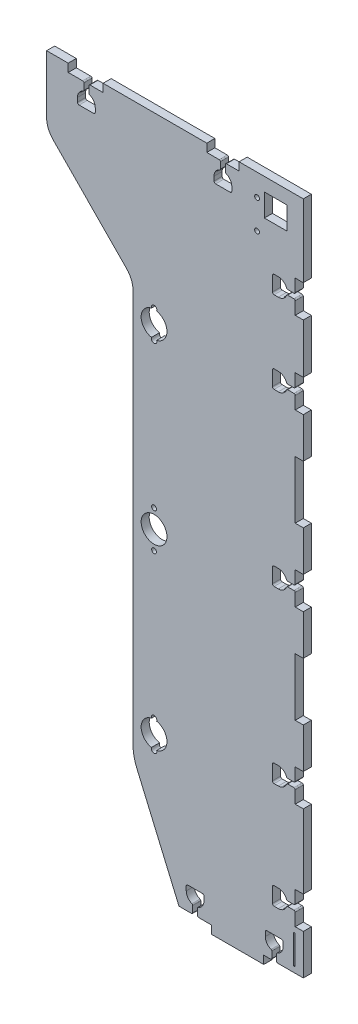
from build123d import *

# Parameters (mm, degrees)
MODEL_3_W           = 1
MODEL_3_H           = 17.999999995
MODEL_3_R           = 1.5
MODEL_3_R_2         = 7.999999998
MODEL_3_W_2         = 13.999999997
MODEL_3_H_2         = 13.999999996
BOSS_EXTRUDE2_DEPTH = 5
MODEL_4_R           = 1.5
CUT_EXTRUDE1_DEPTH  = 2


with BuildPart() as part:
    # Model<3> → Boss-Extrude2 (new body)
    with BuildSketch(Plane.XY):
        with BuildLine():
            Line((546, -45.000049616), (546, 0))
            Line((546, 0), (506.2, 0))
            Line((506.2, 0), (506.2, -4.999995184))
            Line((506.2, -4.999995184), (498.450183235, -4.999995184))
            add(Edge.make_bspline(
                [(497.700181648, -5.750174057), (497.700082843, -5.335890022), (498.035899189, -4.999994295), (498.450183235, -4.999995184)],
                knots=[12, 12, 12, 12, 13, 13, 13, 13], degree=3))
            Line((497.700181648, -5.750174057), (497.701039279, -9.675060997))
            add(Edge.make_bspline(
                [(498.177494802, -10.3691405), (497.890497562, -10.258189749), (497.701556482, -9.982757629), (497.701039279, -9.675060997)],
                knots=[10, 10, 10, 10, 11, 11, 11, 11], degree=3))
            add(Edge.make_bspline(
                [(501.699914986, -15.500447692), (501.700368749, -13.17121262), (500.233348771, -11.167782837), (498.177494802, -10.3691405)],
                knots=[9, 9, 9, 9, 10, 10, 10, 10], degree=3))
            Line((501.699914986, -15.500447692), (501.699914986, -18.100120624))
            add(Edge.make_bspline(
                [(500.699914986, -19.100120624), (501.252199736, -19.100120624), (501.699914986, -18.652405374), (501.699914986, -18.100120624)],
                knots=[7, 7, 7, 7, 8, 8, 8, 8], degree=3))
            Line((500.699914986, -19.100120624), (491.700072268, -19.100120624))
            add(Edge.make_bspline(
                [(490.700072268, -18.100120624), (490.700072268, -18.652405374), (491.147787518, -19.100120624), (491.700072268, -19.100120624)],
                knots=[5, 5, 5, 5, 6, 6, 6, 6], degree=3))
            Line((490.700072268, -18.100120624), (490.700072268, -15.500447692))
            add(Edge.make_bspline(
                [(494.223229174, -10.368798467), (492.166969791, -11.167255583), (490.699594835, -13.170914765), (490.700072268, -15.500447692)],
                knots=[3, 3, 3, 3, 4, 4, 4, 4], degree=3))
            add(Edge.make_bspline(
                [(494.699861114, -9.674560885), (494.699380955, -9.982359671), (494.510347119, -10.257876835), (494.223229174, -10.368798467)],
                knots=[2, 2, 2, 2, 3, 3, 3, 3], degree=3))
            Line((494.699861114, -9.674560885), (494.700037911, -5.750027353))
            add(Edge.make_bspline(
                [(493.965462797, -4.999995184), (494.364264669, -4.999993567), (494.700056571, -5.335800597), (494.700037911, -5.750027353)],
                knots=[0, 0, 0, 0, 1, 1, 1, 1], degree=3))
            Line((493.965462797, -4.999995184), (486.215646033, -4.999995184))
            Line((486.215646033, -4.999995184), (486.2, -4.999995184))
            Line((486.2, -4.999995184), (486.2, 0))
            Line((486.2, 0), (421.975, 0))
            Line((421.975, 0), (421.975, -4.999995184))
            Line((421.975, -4.999995184), (413.870038307, -4.999995184))
            add(Edge.make_bspline(
                [(413.870038307, -4.999995184), (413.455754261, -4.99999518), (413.119938632, -5.335891625), (413.120038323, -5.750175659)],
                knots=[6, 6, 6, 6, 7, 7, 7, 7], degree=3))
            Line((413.120038323, -5.750175659), (413.120825498, -9.675062614))
            add(Edge.make_bspline(
                [(413.120825498, -9.675062614), (413.121342701, -9.982759246), (413.310283781, -10.258191366), (413.59728102, -10.369142117)],
                knots=[8, 8, 8, 8, 9, 9, 9, 9], degree=3))
            add(Edge.make_bspline(
                [(413.59728102, -10.369142117), (415.65313499, -11.167784454), (417.120154968, -13.171214237), (417.119701204, -15.500449309)],
                knots=[9, 9, 9, 9, 10, 10, 10, 10], degree=3))
            Line((417.119701204, -15.500449309), (417.119701204, -18.100122241))
            add(Edge.make_bspline(
                [(417.119701204, -18.100122241), (417.119701205, -18.652406991), (416.671985955, -19.100122241), (416.119701205, -19.100122241)],
                knots=[11, 11, 11, 11, 12, 12, 12, 12], degree=3))
            Line((416.119701205, -19.100122241), (407.119858486, -19.100122241))
            add(Edge.make_bspline(
                [(407.119858486, -19.100122241), (406.567573736, -19.100122241), (406.119858486, -18.652406991), (406.119858486, -18.100122241)],
                knots=[13, 13, 13, 13, 14, 14, 14, 14], degree=3))
            Line((406.119858486, -18.100122241), (406.119858486, -15.500449309))
            add(Edge.make_bspline(
                [(406.119858486, -15.500449309), (406.119381054, -13.170916382), (407.58675601, -11.1672572), (409.643015392, -10.368800084)],
                knots=[15, 15, 15, 15, 16, 16, 16, 16], degree=3))
            add(Edge.make_bspline(
                [(409.643015392, -10.368800084), (409.930133337, -10.257878452), (410.119167173, -9.982361288), (410.119647333, -9.674562503)],
                knots=[16, 16, 16, 16, 17, 17, 17, 17], degree=3))
            Line((410.119647333, -9.674562503), (410.119824129, -5.75002897))
            add(Edge.make_bspline(
                [(410.119824129, -5.75002897), (410.11984279, -5.335802214), (409.784050887, -4.999995184), (409.36982413, -4.999995184)],
                knots=[18, 18, 18, 18, 19, 19, 19, 19], degree=3))
            Line((409.36982413, -4.999995184), (400.375, -4.999995184))
            Line((400.375, -4.999995184), (400.375, 0))
            Line((400.375, 0), (387.000004816, 0))
            Line((387.000004816, 0), (387.000004816, -36))
            ThreePointArc((387.000004816, -36), (388.04243776, -41.301080643), (391.014498528, -45.8127297))
            Line((391.014498528, -45.8127297), (436.509430757, -92.108709079))
            ThreePointArc((436.509430757, -92.108709079), (439.481491525, -96.620358136), (440.523924468, -101.921438779))
            Line((440.523924468, -101.921438779), (440.523924468, -345.813078726))
            ThreePointArc((440.523924468, -345.813078726), (441.09581748, -351.443260518), (442.788134969, -356.843452195))
            Line((442.788134969, -356.843452195), (469, -418.000315354))
            Line((469, -418.000315354), (476.749816765, -418.000315354))
            add(Edge.make_bspline(
                [(477.499608369, -417.249926607), (477.499823121, -417.664210598), (477.164100795, -418.000200297), (476.749816765, -418.000315354)],
                knots=[16, 16, 16, 16, 17, 17, 17, 17], degree=3))
            Line((477.499608369, -417.249926607), (477.479585777, -413.325090645))
            add(Edge.make_bspline(
                [(477.003130255, -412.631011143), (477.290127494, -412.741961893), (477.479068574, -413.017394014), (477.479585777, -413.325090645)],
                knots=[14, 14, 14, 14, 15, 15, 15, 15], degree=3))
            add(Edge.make_bspline(
                [(473.480710071, -407.49970395), (473.480256308, -409.828939023), (474.947276286, -411.832368806), (477.003130255, -412.631011143)],
                knots=[13, 13, 13, 13, 14, 14, 14, 14], degree=3))
            Line((473.480710071, -407.49970395), (473.480710071, -404.900031018))
            add(Edge.make_bspline(
                [(474.480710071, -403.900031018), (473.928425321, -403.900031018), (473.480710071, -404.347746268), (473.480710071, -404.900031018)],
                knots=[11, 11, 11, 11, 12, 12, 12, 12], degree=3))
            Line((474.480710071, -403.900031018), (483.48055279, -403.900031018))
            add(Edge.make_bspline(
                [(484.480552789, -404.900031018), (484.480552789, -404.347746269), (484.032837539, -403.900031018), (483.48055279, -403.900031018)],
                knots=[9, 9, 9, 9, 10, 10, 10, 10], degree=3))
            Line((484.480552789, -404.900031018), (484.480552789, -407.49970395))
            add(Edge.make_bspline(
                [(480.957395883, -412.631353175), (483.013655265, -411.83289606), (484.481030222, -409.829236878), (484.480552789, -407.49970395)],
                knots=[7, 7, 7, 7, 8, 8, 8, 8], degree=3))
            add(Edge.make_bspline(
                [(480.480763942, -413.325590757), (480.481244102, -413.017791971), (480.670277938, -412.742274807), (480.957395883, -412.631353175)],
                knots=[6, 6, 6, 6, 7, 7, 7, 7], degree=3))
            Line((480.480763942, -413.325590757), (480.480744467, -417.250124293))
            add(Edge.make_bspline(
                [(481.230587151, -418.000315354), (480.816360403, -418.000228482), (480.480638934, -417.664351036), (480.480744467, -417.250124293)],
                knots=[4, 4, 4, 4, 5, 5, 5, 5], degree=3))
            Line((481.230587151, -418.000315354), (489, -418.000315354))
            Line((489, -418.000315354), (489, -423.000310538))
            Line((489, -423.000310538), (521.5, -423.000310538))
            Line((521.5, -423.000310538), (521.5, -418.000315354))
            Line((521.5, -418.000315354), (525.730371592, -418.000315354))
            add(Edge.make_bspline(
                [(526.480214256, -417.249977629), (526.480400817, -417.664261633), (526.14465563, -418.000228487), (525.730371592, -418.000315354)],
                knots=[112, 112, 112, 112, 113, 113, 113, 113], degree=3))
            Line((526.480214256, -417.249977629), (526.479584396, -413.325090645))
            add(Edge.make_bspline(
                [(526.003128873, -412.631011143), (526.290126113, -412.741961893), (526.479067193, -413.017394014), (526.479584396, -413.325090645)],
                knots=[110, 110, 110, 110, 111, 111, 111, 111], degree=3))
            add(Edge.make_bspline(
                [(522.480708689, -407.49970395), (522.480254926, -409.828939023), (523.947274904, -411.832368806), (526.003128873, -412.631011143)],
                knots=[109, 109, 109, 109, 110, 110, 110, 110], degree=3))
            Line((522.480708689, -407.49970395), (522.480708689, -404.900031018))
            add(Edge.make_bspline(
                [(523.480708689, -403.900031018), (522.928423939, -403.900031018), (522.480708689, -404.347746268), (522.480708689, -404.900031018)],
                knots=[107, 107, 107, 107, 108, 108, 108, 108], degree=3))
            Line((523.480708689, -403.900031018), (532.480551408, -403.900031018))
            add(Edge.make_bspline(
                [(533.480551408, -404.900031018), (533.480551408, -404.347746269), (533.032836158, -403.900031018), (532.480551408, -403.900031018)],
                knots=[105, 105, 105, 105, 106, 106, 106, 106], degree=3))
            Line((533.480551408, -404.900031018), (533.480551408, -407.49970395))
            add(Edge.make_bspline(
                [(529.957394501, -412.631353175), (532.013653884, -411.83289606), (533.48102884, -409.829236878), (533.480551408, -407.49970395)],
                knots=[103, 103, 103, 103, 104, 104, 104, 104], degree=3))
            add(Edge.make_bspline(
                [(529.480762561, -413.325590757), (529.48124272, -413.017791971), (529.670276556, -412.742274807), (529.957394501, -412.631353175)],
                knots=[102, 102, 102, 102, 103, 103, 103, 103], degree=3))
            Line((529.480762561, -413.325590757), (529.480743085, -417.250124293))
            add(Edge.make_bspline(
                [(530.230585769, -418.000315354), (529.816359021, -418.000228482), (529.480637552, -417.664351036), (529.480743085, -417.250124293)],
                knots=[100, 100, 100, 100, 101, 101, 101, 101], degree=3))
            Line((530.230585769, -418.000315354), (546, -418.000315354))
            Line((546, -418.000315354), (546, -393.000315354))
            Line((546, -393.000315354), (541.000004816, -393.000315354))
            Line((541.000004816, -393.000315354), (541.000004816, -385.250498589))
            add(Edge.make_bspline(
                [(540.249824408, -384.500498538), (540.664108443, -384.500398884), (541.000004857, -384.836214543), (541.000004816, -385.250498589)],
                knots=[95, 95, 95, 95, 96, 96, 96, 96], degree=3))
            Line((540.249824408, -384.500498538), (536.324937387, -384.500821507))
            add(Edge.make_bspline(
                [(535.630171673, -384.976277386), (535.741535769, -384.689439943), (536.017240011, -384.500895552), (536.324937387, -384.500821507)],
                knots=[93, 93, 93, 93, 94, 94, 94, 94], degree=3))
            add(Edge.make_bspline(
                [(530.499256385, -388.498804784), (532.828393271, -388.499142445), (534.831665469, -387.032084475), (535.630171673, -384.976277386)],
                knots=[92, 92, 92, 92, 93, 93, 93, 93], degree=3))
            Line((530.499256385, -388.498804784), (527.899583453, -388.498804784))
            add(Edge.make_bspline(
                [(526.899424235, -387.498964027), (526.899512176, -388.05124877), (527.34729871, -388.498892724), (527.899583453, -388.498804784)],
                knots=[90, 90, 90, 90, 91, 91, 91, 91], degree=3))
            Line((526.899424235, -387.498964027), (526.899424235, -378.499121308))
            add(Edge.make_bspline(
                [(527.899264967, -377.498962066), (527.346980224, -377.49905002), (526.899336281, -377.946836566), (526.899424235, -378.499121308)],
                knots=[88, 88, 88, 88, 89, 89, 89, 89], degree=3))
            Line((527.899264967, -377.498962066), (530.498937899, -377.498962066))
            add(Edge.make_bspline(
                [(535.630587123, -381.022118973), (534.832130008, -378.965859591), (532.828470826, -377.498484634), (530.498937899, -377.498962066)],
                knots=[86, 86, 86, 86, 87, 87, 87, 87], degree=3))
            add(Edge.make_bspline(
                [(536.324824704, -381.498750914), (536.017025919, -381.498270754), (535.741508755, -381.309236918), (535.630587123, -381.022118973)],
                knots=[85, 85, 85, 85, 86, 86, 86, 86], degree=3))
            Line((536.324824704, -381.498750914), (540.249358056, -381.499953617))
            add(Edge.make_bspline(
                [(541.000004816, -380.75056712), (540.999666131, -381.164793738), (540.663584659, -381.500310962), (540.249358056, -381.499953617)],
                knots=[83, 83, 83, 83, 84, 84, 84, 84], degree=3))
            Line((541.000004816, -380.75056712), (541.000004816, -373.000153812))
            Line((541.000004816, -373.000153812), (546, -373.000153812))
            Line((546, -373.000153812), (546, -327.250153812))
            Line((546, -327.250153812), (541.000004816, -327.250153812))
            Line((541.000004816, -327.250153812), (541.000004816, -319.500337047))
            add(Edge.make_bspline(
                [(540.249367335, -318.750794457), (540.663651232, -318.750442249), (540.999752302, -319.086053078), (541.000004816, -319.500337047)],
                knots=[77, 77, 77, 77, 78, 78, 78, 78], degree=3))
            Line((540.249367335, -318.750794457), (536.324480304, -318.750951063))
            add(Edge.make_bspline(
                [(535.62971459, -319.226406943), (535.741078686, -318.939569499), (536.016782928, -318.751025108), (536.324480304, -318.750951063)],
                knots=[75, 75, 75, 75, 76, 76, 76, 76], degree=3))
            add(Edge.make_bspline(
                [(530.499093608, -322.749686579), (532.828299069, -322.749729827), (534.831444762, -321.28237546), (535.62971459, -319.226406943)],
                knots=[74, 74, 74, 74, 75, 75, 75, 75], degree=3))
            Line((530.499093608, -322.749686579), (527.899420676, -322.749686579))
            add(Edge.make_bspline(
                [(526.899424235, -321.74968302), (526.89942227, -322.30196777), (527.347135926, -322.749684614), (527.899420676, -322.749686579)],
                knots=[72, 72, 72, 72, 73, 73, 73, 73], degree=3))
            Line((526.899424235, -321.74968302), (526.899424235, -312.749840301))
            add(Edge.make_bspline(
                [(527.900040588, -311.750457034), (527.347755943, -311.750116527), (526.899764742, -312.197555657), (526.899424235, -312.749840301)],
                knots=[70, 70, 70, 70, 71, 71, 71, 71], degree=3))
            Line((527.900040588, -311.750457034), (530.49971352, -311.750457034))
            add(Edge.make_bspline(
                [(535.631222491, -315.273818205), (534.832847229, -313.217527043), (532.829246461, -311.750072332), (530.49971352, -311.750457034)],
                knots=[68, 68, 68, 68, 69, 69, 69, 69], degree=3))
            add(Edge.make_bspline(
                [(536.325441056, -315.750477752), (536.017642309, -315.74998534), (535.742132687, -315.560940548), (535.631222491, -315.273818205)],
                knots=[67, 67, 67, 67, 68, 68, 68, 68], degree=3))
            Line((536.325441056, -315.750477752), (540.24997459, -315.750341487))
            add(Edge.make_bspline(
                [(541.000004816, -315.000337928), (541.000006783, -315.414564685), (540.664201346, -315.750358181), (540.24997459, -315.750341487)],
                knots=[65, 65, 65, 65, 66, 66, 66, 66], degree=3))
            Line((541.000004816, -315.000337928), (541.000004816, -307.249924619))
            Line((541.000004816, -307.249924619), (546, -307.249924619))
            Line((546, -307.249924619), (546, -282.249924619))
            Line((546, -282.249924619), (541.000004816, -282.249924619))
            Line((541.000004816, -282.249924619), (541.000004816, -246.499924619))
            Line((541.000004816, -246.499924619), (546, -246.499924619))
            Line((546, -246.499924619), (546, -221.499924619))
            Line((546, -221.499924619), (541.000004816, -221.499924619))
            Line((541.000004816, -221.499924619), (541.000004816, -213.750107855))
            add(Edge.make_bspline(
                [(540.248143442, -213.00179295), (540.66242621, -213.000763724), (540.999075284, -213.335824851), (541.000004816, -213.750107855)],
                knots=[55, 55, 55, 55, 56, 56, 56, 56], degree=3))
            Line((540.248143442, -213.00179295), (536.323256526, -213.000833683))
            add(Edge.make_bspline(
                [(535.629251123, -213.477396783), (535.740157315, -213.190382399), (536.015560051, -213.001398629), (536.323256526, -213.000833683)],
                knots=[53, 53, 53, 53, 54, 54, 54, 54], degree=3))
            add(Edge.make_bspline(
                [(530.498489816, -217.000613604), (532.827725258, -217.000705958), (534.830927673, -215.533374935), (535.629251123, -213.477396783)],
                knots=[52, 52, 52, 52, 53, 53, 53, 53], degree=3))
            Line((530.498489816, -217.000613604), (527.898816884, -217.000613604))
            add(Edge.make_bspline(
                [(526.899424235, -216.000006621), (526.899088906, -216.552291269), (527.346532236, -217.000278275), (527.898816884, -217.000613604)],
                knots=[50, 50, 50, 50, 51, 51, 51, 51], degree=3))
            Line((526.899424235, -216.000006621), (526.899424235, -207.000163902))
            add(Edge.make_bspline(
                [(527.899871774, -206.000611642), (527.347587079, -206.000364417), (526.899671459, -206.447879208), (526.899424235, -207.000163902)],
                knots=[48, 48, 48, 48, 49, 49, 49, 49], degree=3))
            Line((527.899871774, -206.000611642), (530.499544706, -206.000611642))
            add(Edge.make_bspline(
                [(535.630479962, -209.524808483), (534.832439549, -207.468387291), (532.829077731, -206.000606291), (530.499544706, -206.000611642)],
                knots=[46, 46, 46, 46, 47, 47, 47, 47], degree=3))
            add(Edge.make_bspline(
                [(536.325439608, -210.000388702), (536.017640095, -210.000374836), (535.741836558, -209.811758389), (535.630479962, -209.524808483)],
                knots=[45, 45, 45, 45, 46, 46, 46, 46], degree=3))
            Line((536.325439608, -210.000388702), (540.249973143, -210.00034004))
            add(Edge.make_bspline(
                [(541.000004816, -209.250337928), (541.000005984, -209.664564685), (540.6641999, -210.000357534), (540.249973143, -210.00034004)],
                knots=[43, 43, 43, 43, 44, 44, 44, 44], degree=3))
            Line((541.000004816, -209.250337928), (541.000004816, -201.499924619))
            Line((541.000004816, -201.499924619), (546, -201.499924619))
            Line((546, -201.499924619), (546, -176.499924619))
            Line((546, -176.499924619), (541.000004816, -176.499924619))
            Line((541.000004816, -176.499924619), (541.000004816, -140.749924619))
            Line((541.000004816, -140.749924619), (546, -140.749924619))
            Line((546, -140.749924619), (546, -115.750049616))
            Line((546, -115.750049616), (541.000004816, -115.750049616))
            Line((541.000004816, -115.750049616), (541.000004816, -108.00017058))
            add(Edge.make_bspline(
                [(540.249070095, -107.250925783), (540.663353819, -107.250409253), (540.99958798, -107.585886743), (541.000004816, -108.00017058)],
                knots=[33, 33, 33, 33, 34, 34, 34, 34], degree=3))
            Line((540.249070095, -107.250925783), (536.324183083, -107.251338023))
            add(Edge.make_bspline(
                [(535.63010358, -107.727793546), (535.74105433, -107.440796306), (536.016486451, -107.251855226), (536.324183083, -107.251338023)],
                knots=[31, 31, 31, 31, 32, 32, 32, 32], degree=3))
            add(Edge.make_bspline(
                [(530.498796387, -111.250213728), (532.828031459, -111.250667492), (534.831461242, -109.783647515), (535.63010358, -107.727793546)],
                knots=[30, 30, 30, 30, 31, 31, 31, 31], degree=3))
            Line((530.498796387, -111.250213728), (527.899123455, -111.250213728))
            add(Edge.make_bspline(
                [(526.899424235, -110.249913038), (526.899258144, -110.802197763), (527.34683873, -111.250047637), (527.899123455, -111.250213728)],
                knots=[28, 28, 28, 28, 29, 29, 29, 29], degree=3))
            Line((526.899424235, -110.249913038), (526.899424235, -101.250070319))
            add(Edge.make_bspline(
                [(527.899724836, -100.25037101), (527.347440111, -100.250204968), (526.899590277, -100.697785594), (526.899424235, -101.250070319)],
                knots=[26, 26, 26, 26, 27, 27, 27, 27], degree=3))
            Line((527.899724836, -100.25037101), (530.499397768, -100.25037101))
            add(Edge.make_bspline(
                [(535.631183762, -103.773328708), (534.832646823, -101.717100321), (532.828930677, -100.249803146), (530.499397768, -100.25037101)],
                knots=[24, 24, 24, 24, 25, 25, 25, 25], degree=3))
            add(Edge.make_bspline(
                [(536.325439886, -104.249933726), (536.017641064, -104.249465515), (535.742116546, -104.060442364), (535.631183762, -103.773328708)],
                knots=[23, 23, 23, 23, 24, 24, 24, 24], degree=3))
            Line((536.325439886, -104.249933726), (540.249973422, -104.249958794))
            add(Edge.make_bspline(
                [(541.000004816, -103.499956403), (541.000006137, -103.91418316), (540.664200178, -104.249976133), (540.249973422, -104.249958794)],
                knots=[21, 21, 21, 21, 22, 22, 22, 22], degree=3))
            Line((541.000004816, -103.499956403), (541.000004816, -95.750049616))
            Line((541.000004816, -95.750049616), (546, -95.750049616))
            Line((546, -95.750049616), (546, -65.000049616))
            Line((546, -65.000049616), (541.000004816, -65.000049616))
            Line((541.000004816, -65.000049616), (541.000004816, -57.25017058))
            add(Edge.make_bspline(
                [(540.249370897, -56.500624423), (540.663654795, -56.500274184), (540.999754271, -56.835886609), (541.000004816, -57.25017058)],
                knots=[15, 15, 15, 15, 16, 16, 16, 16], degree=3))
            Line((540.249370897, -56.500624423), (536.324483863, -56.500661326))
            add(Edge.make_bspline(
                [(535.63040436, -56.977116849), (535.741355111, -56.690119609), (536.016787232, -56.501178529), (536.324483863, -56.500661326)],
                knots=[13, 13, 13, 13, 14, 14, 14, 14], degree=3))
            add(Edge.make_bspline(
                [(530.499097167, -60.499537031), (532.828332239, -60.499990795), (534.831762023, -59.032970818), (535.63040436, -56.977116849)],
                knots=[12, 12, 12, 12, 13, 13, 13, 13], degree=3))
            Line((530.499097167, -60.499537031), (527.899424235, -60.499537031))
            add(Edge.make_bspline(
                [(526.899424235, -59.499537031), (526.899424235, -60.051821781), (527.347139485, -60.499537031), (527.899424235, -60.499537031)],
                knots=[10, 10, 10, 10, 11, 11, 11, 11], degree=3))
            Line((526.899424235, -59.499537031), (526.899424235, -50.499694313))
            add(Edge.make_bspline(
                [(527.89987776, -49.500148043), (527.347593067, -49.499897511), (526.899674767, -49.94740962), (526.899424235, -50.499694313)],
                knots=[8, 8, 8, 8, 9, 9, 9, 9], degree=3))
            Line((527.89987776, -49.500148043), (530.499550692, -49.500148043))
            add(Edge.make_bspline(
                [(535.631199916, -53.02330495), (534.832742801, -50.967045568), (532.829083619, -49.499670611), (530.499550692, -49.500148043)],
                knots=[6, 6, 6, 6, 7, 7, 7, 7], degree=3))
            add(Edge.make_bspline(
                [(536.325437497, -53.499936891), (536.017638712, -53.499456731), (535.742121548, -53.310422895), (535.631199916, -53.02330495)],
                knots=[5, 5, 5, 5, 6, 6, 6, 6], degree=3))
            Line((536.325437497, -53.499936891), (540.249971033, -53.499956406))
            add(Edge.make_bspline(
                [(541.000004816, -52.749956403), (541.000004818, -53.16418316), (540.66419779, -53.499975064), (540.249971033, -53.499956406)],
                knots=[3, 3, 3, 3, 4, 4, 4, 4], degree=3))
            Line((541.000004816, -52.749956403), (541.000004816, -45.000049616))
            Line((541.000004816, -45.000049616), (546, -45.000049616))
        make_face()
        with Locations((540.500004816, -405.499988277)):
            Rectangle(MODEL_3_W, MODEL_3_H, mode=Mode.SUBTRACT)
        with BuildLine():
            ThreePointArc((455.143804542, -341.328481021), (453.54463361, -343.700224656), (451.945462679, -341.328481021))
            ThreePointArc((451.945462679, -341.328481021), (445.54463361, -333.489944656), (451.945462679, -325.651408292))
            ThreePointArc((451.945462679, -325.651408292), (453.54463361, -323.279664657), (455.143804542, -325.651408292))
            ThreePointArc((455.143804542, -325.651408292), (461.54463361, -333.489944656), (455.143804542, -341.328481021))
        make_face(mode=Mode.SUBTRACT)
        with Locations((453.54463361, -234.989945577)):
            Circle(MODEL_3_R, mode=Mode.SUBTRACT)
        with Locations((453.54463361, -223.489944656)):
            Circle(MODEL_3_R_2, mode=Mode.SUBTRACT)
        with Locations((453.54463361, -211.989943735)):
            Circle(MODEL_3_R, mode=Mode.SUBTRACT)
        with BuildLine():
            ThreePointArc((455.143804542, -105.651408292), (461.54463361, -113.489944656), (455.143804542, -121.328481021))
            ThreePointArc((455.143804542, -121.328481021), (453.54463361, -123.700224656), (451.945462679, -121.328481021))
            ThreePointArc((451.945462679, -121.328481021), (445.54463361, -113.489944656), (451.945462679, -105.651408292))
            ThreePointArc((451.945462679, -105.651408292), (453.54463361, -103.279664657), (455.143804542, -105.651408292))
        make_face(mode=Mode.SUBTRACT)
        with Locations((528.880000002, -15.349999998)):
            Rectangle(MODEL_3_W_2, MODEL_3_H_2, mode=Mode.SUBTRACT)
        with Locations((517.380000004, -31.6)):
            Circle(MODEL_3_R, mode=Mode.SUBTRACT)
        with Locations((517.380000004, -13.6)):
            Circle(MODEL_3_R, mode=Mode.SUBTRACT)
    extrude(amount=BOSS_EXTRUDE2_DEPTH)

    # Model<4> → Cut-Extrude1 (cut)
    # profile 1 of 2: a face of its own
    with BuildSketch(Plane.XY):
        Polygon((520.130000004, -12.01228676), (517.380000004, -10.424573519), (514.630000004, -12.01228676), (514.630000004, -15.18771324), (517.380000004, -16.775426481), (520.130000004, -15.18771324), align=None)
        with Locations((517.380000004, -13.6)):
            Circle(MODEL_4_R, mode=Mode.SUBTRACT)
    # profile 2 of 2: a face of its own
    with BuildSketch(Plane.XY):
        Polygon((520.129975569, -30.01232908), (517.380000004, -28.424573519), (514.630024438, -30.01232908), (514.630024438, -33.187755561), (517.380000004, -34.775511122), (520.129975569, -33.187755561), align=None)
        with Locations((517.380000004, -31.6)):
            Circle(MODEL_4_R, mode=Mode.SUBTRACT)
    extrude(amount=CUT_EXTRUDE1_DEPTH, mode=Mode.SUBTRACT)


solid = part.part
